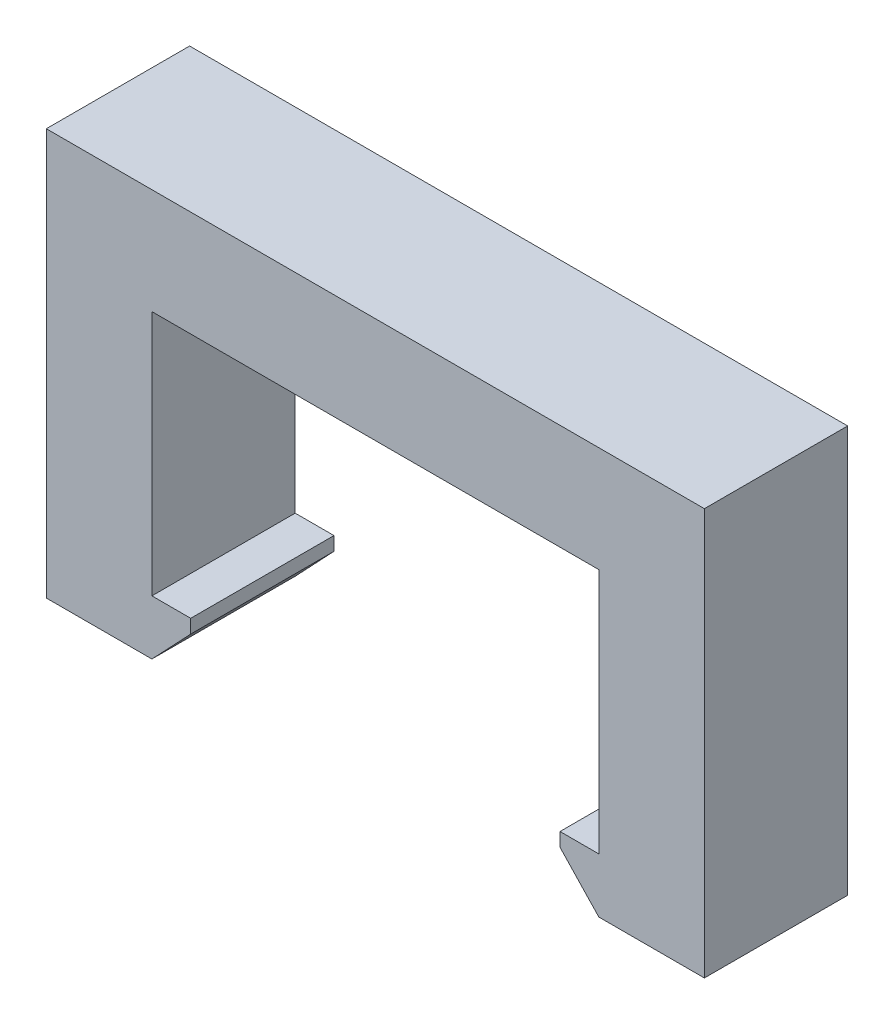
from build123d import *

# Parameters (mm, degrees)
BOSS_EXTRUDE1_DEPTH = 12.8016


with BuildPart() as part:
    # Sketch1 → Boss-Extrude1 (new body)
    with BuildSketch(Plane(origin=(0, 0, 0), x_dir=(0, 1, 0), z_dir=(0, 0, 1))):
        Polygon((-9.432561068, 19.9644), (-9.432561068, -19.9644), (-31.428961068, -19.9644), (-31.428961068, -16.4973), (-32.650548822, -16.4973), (-36.315312084, -19.9644), (-36.315312084, -29.396961068), (0, -29.396961068), (0, 0), (0, 29.396961068), (-36.315312084, 29.396961068), (-36.315312084, 19.9644), (-32.650548822, 16.4973), (-31.428961068, 16.4973), (-31.428961068, 19.9644), align=None)
    extrude(amount=BOSS_EXTRUDE1_DEPTH)


solid = part.part
